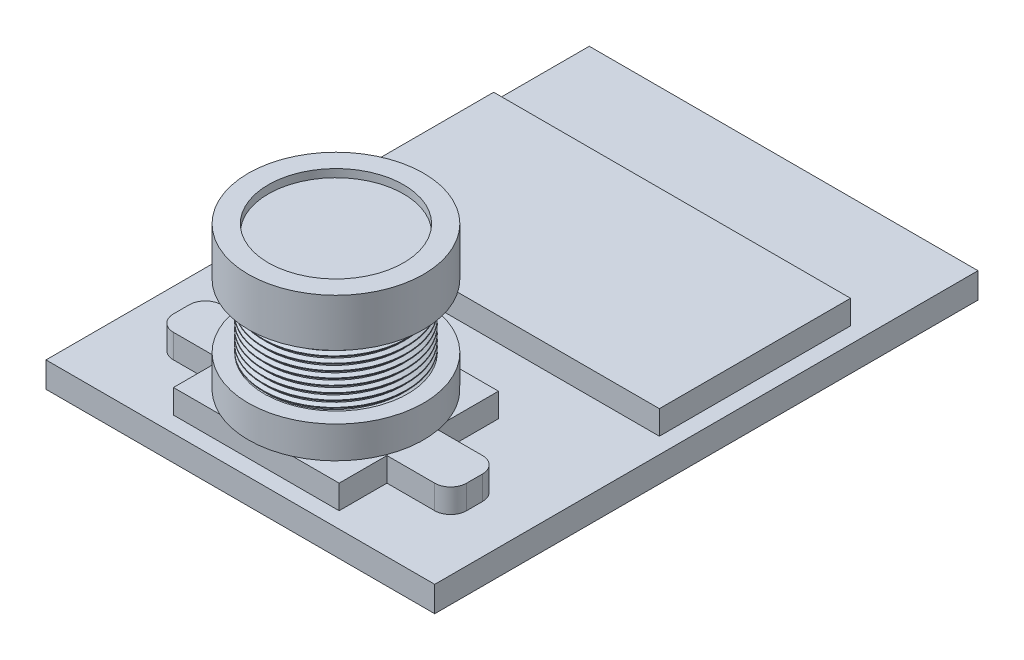
from build123d import *

# Parameters (mm, degrees)
SKETCH1_W           = 24.4
SKETCH1_H           = 1.6
BOSS_EXTRUDE1_DEPTH = 34.1
SKETCH2_W           = 10.4
SKETCH2_H           = 10
BOSS_EXTRUDE2_DEPTH = 1.5
SKETCH3_W           = 18.4
SKETCH3_H           = 3
BOSS_EXTRUDE3_DEPTH = 1.5
FILLET1_R           = 1
SKETCH4_R           = 5.5
BOSS_EXTRUDE4_DEPTH = 2
SKETCH5_R           = 4.5
BOSS_EXTRUDE5_DEPTH = 4
THREAD1_PITCH       = 0.4
SKETCH9_R           = 5.5
BOSS_EXTRUDE6_DEPTH = 3
SKETCH11_R          = 4.246638391
CUT_EXTRUDE1_DEPTH  = 0.5
SKETCH12_W          = 22.4
SKETCH12_H          = 12
BOSS_EXTRUDE7_DEPTH = 1.5
SKETCH13_W          = 20
SKETCH13_H          = 20
BOSS_EXTRUDE8_DEPTH = 1.5


with BuildPart() as part:
    # Sketch1 → Boss-Extrude1 (new body)
    with BuildSketch(Plane.XY):
        with Locations((-1.963218391, 1.618965517)):
            Rectangle(SKETCH1_W, SKETCH1_H)
    extrude(amount=BOSS_EXTRUDE1_DEPTH)

    # Sketch2 → Boss-Extrude2 (add)
    with BuildSketch(Plane(origin=(0, 2.418965517, 0), x_dir=(1, 0, 0), z_dir=(0, 1, 0))):
        with Locations((-1.963218391, -28.1)):
            Rectangle(SKETCH2_W, SKETCH2_H)
    extrude(amount=BOSS_EXTRUDE2_DEPTH)

    # Sketch3 → Boss-Extrude3 (add)
    with BuildSketch(Plane(origin=(0, 3.918965517, 0), x_dir=(1, 0, 0), z_dir=(0, 1, 0))):
        with Locations((-1.963218391, -28.6)):
            Rectangle(SKETCH3_W, SKETCH3_H)
    extrude(amount=-BOSS_EXTRUDE3_DEPTH)

    # Fillet1
    fillet1_edges = [part.edges().sort_by_distance(p)[0] for p in [
        (7.236781609, 3.168965517, 30.1),
        (-11.163218391, 3.168965517, 27.1),
        (7.236781609, 3.168965517, 27.1),
        (-11.163218391, 3.168965517, 30.1),
    ]]
    fillet(fillet1_edges, radius=FILLET1_R)

    # Sketch4 → Boss-Extrude4 (add)
    with BuildSketch(Plane(origin=(0, 3.918965517, 0), x_dir=(1, 0, 0), z_dir=(0, 1, 0))):
        with Locations(Location((-1.963218391, -28.1, 0), (0, 0, 65.380022671))):
            Circle(SKETCH4_R)
    extrude(amount=BOSS_EXTRUDE4_DEPTH)

    # Sketch5 → Boss-Extrude5 (add)
    with BuildSketch(Plane(origin=(0, 5.918965517, 0), x_dir=(1, 0, 0), z_dir=(0, 1, 0))):
        with Locations(Location((-1.963218391, -28.1, 0), (0, 0, 270))):
            Circle(SKETCH5_R)
    extrude(amount=BOSS_EXTRUDE5_DEPTH)

    # Thread1: the profile of Thread Profile1 profile screwed along a right-hand helix of 10 turns, 6 arcs to a turn; built about Z, then put on its axis
    thread1_z = Axis((0, 0, 0), (0, 0, 1))
    thread1_corners = [(4.5003, 0, -0.000173205), (4.5003, 0, 0.350173204), (4.28349365, 0, 0.224999999), (4.28349365, 0, 0.124999999)]
    with BuildLine(mode=Mode.PRIVATE) as thread1_profile:
        Line(thread1_corners[0], thread1_corners[1])
        Line(thread1_corners[1], thread1_corners[2])
        Line(thread1_corners[2], thread1_corners[3])
        Line(thread1_corners[3], thread1_corners[0])
    thread1_cap = Face(thread1_profile.wire())
    thread1_turn_angles = [0, 30, 60, 90, 120, 150, 180, 210, 240, 270, 300, 330, 360]
    thread1_turn_weights = [1, 0.8660254037844387, 1, 0.8660254037844387, 1, 0.8660254037844387, 1, 0.8660254037844387, 1, 0.8660254037844387, 1, 0.8660254037844387, 1]
    thread1_turn_rails = [Edge.make_bspline([Vector(p[0], p[1], 0).rotate(thread1_z, thread1_turn_angles[k]) / thread1_turn_weights[k] + Vector(0, 0, p[2] + THREAD1_PITCH * thread1_turn_angles[k] / 360) for k in range(13)], [0, 0, 0, 1, 1, 2, 2, 3, 3, 4, 4, 5, 5, 6, 6, 6], 2, thread1_turn_weights) for p in thread1_corners]
    thread1_turn_sides = [Face.make_surface_from_curves(thread1_turn_rails[p[0]], thread1_turn_rails[p[1]]) for p in [(0, 1), (1, 2), (2, 3), (3, 0)]]
    thread1 = Plane(origin=(-1.963218391, 9.918965517, 28.1), x_dir=(-1, 0, 0), z_dir=(0, -1, 0)) * Solid(Shell([*[p.moved(Location((0, 0, THREAD1_PITCH * i))) for i in range(10) for p in thread1_turn_sides], thread1_cap, thread1_cap.rotate(thread1_z, 3600).moved(Location((0, 0, THREAD1_PITCH * 3600 / 360)))]))
    add(thread1, mode=Mode.SUBTRACT)

    # Sketch9 → Boss-Extrude6 (add)
    with BuildSketch(Plane(origin=(0, 9.918965517, 0), x_dir=(1, 0, 0), z_dir=(0, 1, 0))):
        with Locations(Location((-1.963218391, -28.1, 0), (0, 0, 65.380022671))):
            Circle(SKETCH9_R)
    extrude(amount=BOSS_EXTRUDE6_DEPTH)

    # Sketch11 → Cut-Extrude1 (cut)
    with BuildSketch(Plane(origin=(0, 12.918965517, 0), x_dir=(1, 0, 0), z_dir=(0, 1, 0))):
        with Locations(Location((-1.963218391, -28.1, 0), (0, 0, 270))):
            Circle(SKETCH11_R)
    extrude(amount=-CUT_EXTRUDE1_DEPTH, mode=Mode.SUBTRACT)

    # Sketch12 → Boss-Extrude7 (add)
    with BuildSketch(Plane(origin=(0, 2.418965517, 0), x_dir=(1, 0, 0), z_dir=(0, 1, 0))):
        with Locations((-1.963218391, -13)):
            Rectangle(SKETCH12_W, SKETCH12_H)
    extrude(amount=BOSS_EXTRUDE7_DEPTH)

    # Sketch13 → Boss-Extrude8 (add)
    with BuildSketch(Plane.XZ.offset(-0.818965517)):
        with Locations((-1.963218391, 16.1)):
            Rectangle(SKETCH13_W, SKETCH13_H)
    extrude(amount=BOSS_EXTRUDE8_DEPTH)


solid = part.part
